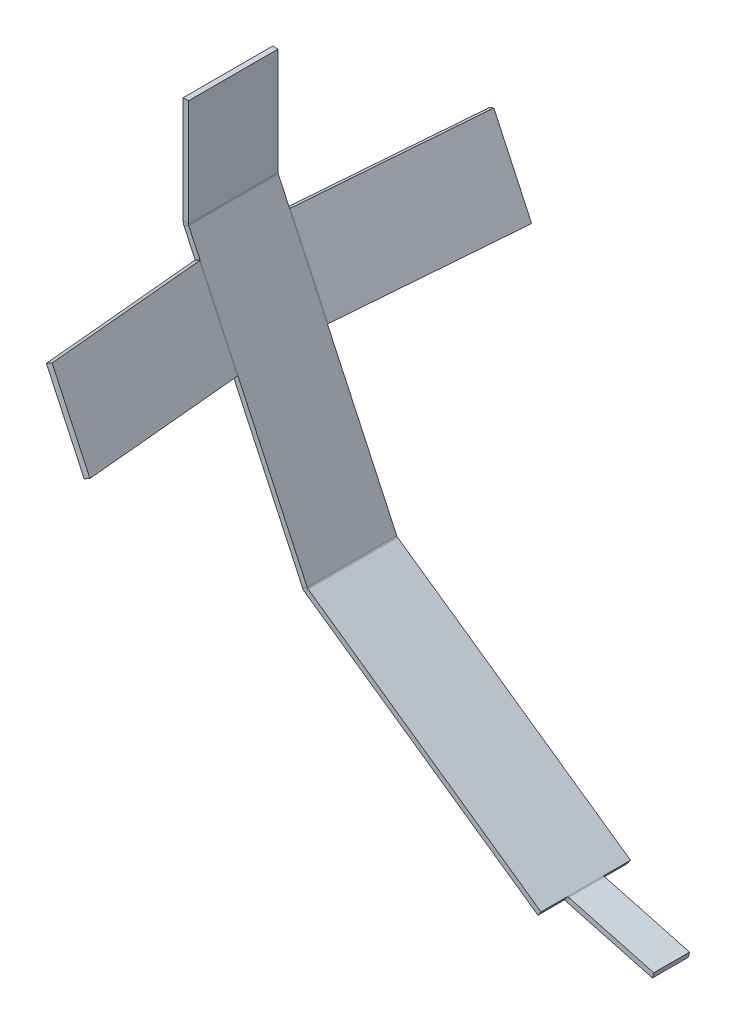
from build123d import *

# Parameters (mm, degrees)
SKETCH1_W                    = 25
SKETCH1_H                    = 30
BASE_FLANGE1_DEPTH           = 1.5
EDGE_FLANGE1_STRIP_CUT_DEPTH = 25
EDGE_FLANGE1_DEPTH           = 25
EDGE_FLANGE2_STRIP_CUT_DEPTH = 25
EDGE_FLANGE2_DEPTH           = 25
EDGE_FLANGE3_DEPTH           = 10
EDGE_FLANGE4_DEPTH           = 25
EDGE_FLANGE4_BEND_DEPTH      = 25


# Sheet-metal steps are written as plain solids
with BuildPart() as part:
    # Sketch1 → Base-Flange1 (new body)
    with BuildSketch(Plane(origin=(0, 0, 0), x_dir=(0, 0, -1), z_dir=(1, 0, 0))):
        Rectangle(SKETCH1_W, SKETCH1_H)
    extrude(amount=BASE_FLANGE1_DEPTH)

    # Edge-Flange1 strip (across the edge) → Edge-Flange1 strip cut (cut)
    with BuildSketch(Plane(origin=(1.5, -15, 12.5), x_dir=(0.9063077870366524, 0.4226182617406943, 0), z_dir=(0, 0, -1))):
        Polygon((-4.44875879, 5.991091638), (-1.290447996, -0.781927716), (0.069013684, -0.148000323), (-3.08929711, 6.625019031), align=None)
    extrude(amount=EDGE_FLANGE1_STRIP_CUT_DEPTH, mode=Mode.SUBTRACT)

    # Edge-Flange1 section (across the edge) → Edge-Flange1 (add)
    with BuildSketch(Plane(origin=(1.5, -15, 12.5), x_dir=(0.9063077870366524, 0.4226182617406943, 0), z_dir=(0, 0, -1))):
        with BuildLine():
            Line((-1.5, 0.163300289), (-1.5, 78.667458006))
            Line((-1.5, 78.667458006), (0, 78.667458006))
            Line((0, 78.667458006), (0, 0.163300289))
            ThreePointArc((0, 0.163300289), (0.017460361, 0.003870869), (0.069013684, -0.148000323))
            Line((0.069013684, -0.148000323), (-1.290447996, -0.781927716))
            ThreePointArc((-1.290447996, -0.781927716), (-1.44698365, -0.320788552), (-1.5, 0.163300289))
        make_face()
    extrude(amount=EDGE_FLANGE1_DEPTH)

    # Edge-Flange2 strip (across the edge) → Edge-Flange2 strip cut (cut)
    with BuildSketch(Plane(origin=(34.746304358, -86.296929777, 12.5), x_dir=(0.5735764363510556, 0.8191520442889852, 0), z_dir=(0, 0, -1))):
        Polygon((-4.936952418, 5.551052423), (-1.200352418, -0.920928625), (0.098685688, -0.170928625), (-3.637914312, 6.301052423), align=None)
    extrude(amount=EDGE_FLANGE2_STRIP_CUT_DEPTH, mode=Mode.SUBTRACT)

    # Edge-Flange2 section (across the edge) → Edge-Flange2 (add)
    with BuildSketch(Plane(origin=(34.746304358, -86.296929777, 12.5), x_dir=(0.5735764363510556, 0.8191520442889852, 0), z_dir=(0, 0, -1))):
        with BuildLine():
            Line((-1.5, 0.197371375), (-1.5, 79.598076211))
            Line((-1.5, 79.598076211), (0, 79.598076211))
            Line((0, 79.598076211), (0, 0.197371375))
            ThreePointArc((0, 0.197371375), (0.025099036, 0.006725267), (0.098685688, -0.170928625))
            Line((0.098685688, -0.170928625), (-1.200352418, -0.920928625))
            ThreePointArc((-1.200352418, -0.920928625), (-1.423789703, -0.381503301), (-1.5, 0.197371375))
        make_face()
    extrude(amount=EDGE_FLANGE2_DEPTH)

    # Edge-Flange3 section (across the edge) → Edge-Flange3 (add)
    with BuildSketch(Plane(origin=(100.055624686, -132.027008186, 5), x_dir=(0.2588190451025379, 0.9659258262890636, 0), z_dir=(0, 0, -1))):
        with BuildLine():
            Line((-1.5, 0.129882454), (-1.5, 24.735509529))
            Line((-1.5, 24.735509529), (0, 24.735509529))
            Line((0, 24.735509529), (0, 0.129882454))
            ThreePointArc((0, 0.129882454), (0.011190609, 0.001973206), (0.044422416, -0.122049584))
            Line((0.044422416, -0.122049584), (-1.365116516, -0.635079799))
            ThreePointArc((-1.365116516, -0.635079799), (-1.46602102, -0.25849906), (-1.5, 0.129882454))
        make_face()
    extrude(amount=EDGE_FLANGE3_DEPTH)

    # Edge-Flange4 section (across the edge) → Edge-Flange4 (add)
    with BuildSketch(Plane(origin=(4.738650647, -21.945308726, 12.56444415), x_dir=(0.8925389352890336, 0.41619774072677873, -0.17364817766692378), z_dir=(0.42261826174069417, -0.9063077870366525, 0))):
        with BuildLine():
            Line((-1.5, 0.06444415), (-1.5, 49.868767005))
            Line((-1.5, 49.868767005), (0, 49.868767005))
            Line((0, 49.868767005), (0, 0.06444415))
            ThreePointArc((0, 0.06444415), (0.002802985, 0.000245229), (0.011190609, -0.063465098))
            Line((0.011190609, -0.063465098), (-1.46602102, -0.323937365))
            ThreePointArc((-1.46602102, -0.323937365), (-1.491489062, -0.130488385), (-1.5, 0.06444415))
        make_face()
    extrude(amount=EDGE_FLANGE4_DEPTH)

    # Edge-Flange4 section 2 (across the edge) → Edge-Flange4 bend (add)
    with BuildSketch(Plane(origin=(15.304107191, -44.603003402, -12.56444415), x_dir=(0.8925389352890335, 0.41619774072677895, 0.17364817766692367), z_dir=(-0.4226182617406944, 0.9063077870366524, 0))):
        with BuildLine():
            Line((-1.5, 0.06444415), (-1.5, 49.868767005))
            Line((-1.5, 49.868767005), (0, 49.868767005))
            Line((0, 49.868767005), (0, 0.06444415))
            ThreePointArc((0, 0.06444415), (0.002802985, 0.000245229), (0.011190609, -0.063465098))
            Line((0.011190609, -0.063465098), (-1.46602102, -0.323937365))
            ThreePointArc((-1.46602102, -0.323937365), (-1.491489062, -0.130488385), (-1.5, 0.06444415))
        make_face()
    extrude(amount=EDGE_FLANGE4_BEND_DEPTH)


solid = part.part
